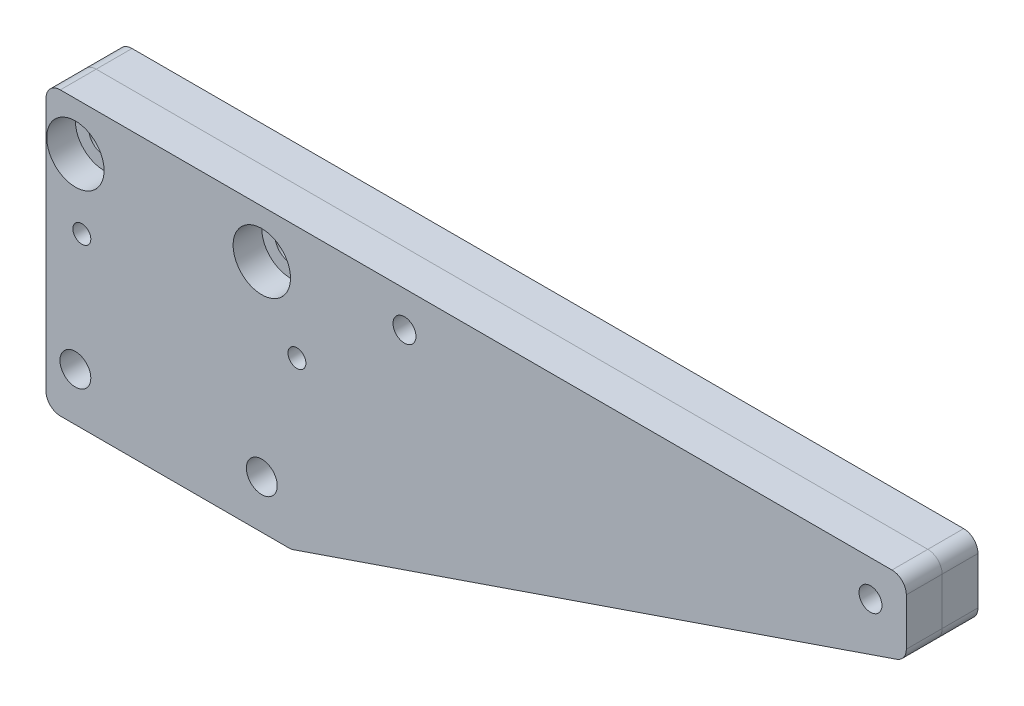
from build123d import *

# Parameters (mm, degrees)
BOSS_EXTRUDE1_DEPTH            = 5
CBORE_FOR_M4_SHCS1_D           = 4.3
CBORE_FOR_M4_SHCS1_CBORE_D     = 8
CBORE_FOR_M4_SHCS1_CBORE_DEPTH = 4
M4_CLEARANCE_HOLE1_D           = 4.3
TAP_DRILL_FOR_M3X0_5_TAP1_D    = 2.5
M3_CLEARANCE_HOLE2_D           = 3.2
FILLET1_R                      = 2


with BuildPart() as part:
    # Sketch1 → Boss-Extrude1 (new body)
    with BuildSketch(Plane.XY):
        Polygon((17.1, 19.7), (102.9, 19.7), (102.9, 9.7), (17.1, -19.7), (-17.1, -19.7), (-17.1, 19.7), align=None)
    extrude(amount=BOSS_EXTRUDE1_DEPTH)

    # CBORE for M4 SHCS1 (through all)
    with Locations(Plane.XY.offset(5)):
        with Locations((13, 13), (-13, 13)):
            CounterBoreHole(CBORE_FOR_M4_SHCS1_D / 2, CBORE_FOR_M4_SHCS1_CBORE_D / 2, CBORE_FOR_M4_SHCS1_CBORE_DEPTH)

    # M4 Clearance Hole1 (through all)
    with Locations(Plane.XY.offset(5)):
        with Locations((-13, -13), (13, -13)):
            Hole(M4_CLEARANCE_HOLE1_D / 2)

    # Tap Drill for M3x0.5 Tap1 (through all)
    with Locations(Plane.XY.offset(5)):
        with Locations((-12.1, 3.8), (17.9, 3.8)):
            Hole(TAP_DRILL_FOR_M3X0_5_TAP1_D / 2)

    # M3 Clearance Hole2 (through all)
    with Locations(Plane(origin=(0, 0, 0), x_dir=(-1, 0, 0), z_dir=(0, 0, -1))):
        with Locations((-97.9, 14.7), (-32.9, 14.7)):
            Hole(M3_CLEARANCE_HOLE2_D / 2)

    # Fillet1
    fillet1_edges = [part.edges().sort_by_distance(p)[0] for p in [
        (17.1, -19.7, 2.5),
        (-17.1, -19.7, 2.5),
        (102.9, 19.7, 2.5),
        (-17.1, 19.7, 2.5),
        (102.9, 9.7, 2.5),
    ]]
    fillet(fillet1_edges, radius=FILLET1_R)


with BuildPart() as body_2:
    # Mirror1: mirrored copy
    add(part.part.mirror(Plane.XY))


solid = Compound([part.part, body_2.part])
